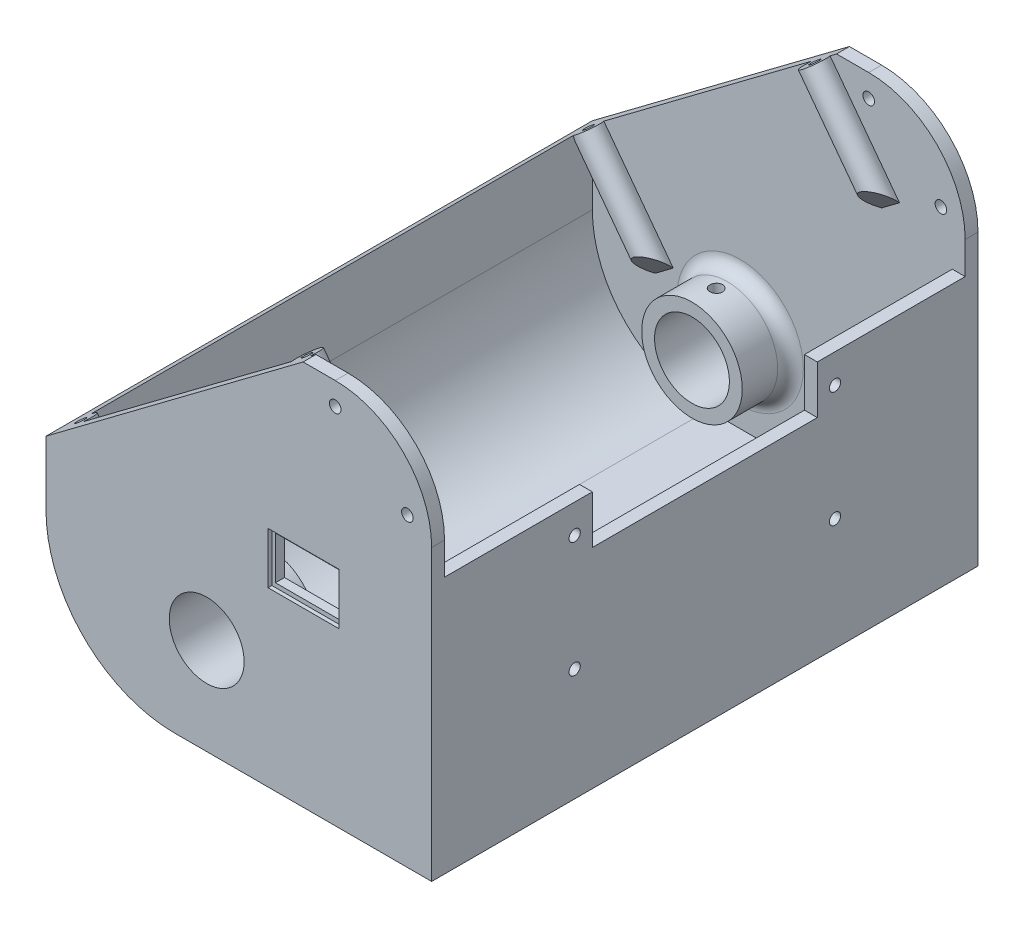
from build123d import *

# Parameters (mm, degrees)
SKETCH_1_R           = 11.65
SKETCH_1_R_2         = 1.8
EXTRUDE_1_DEPTH      = 170
SHELL_2_T            = -4
SKETCH_10_W          = 162
SKETCH_10_H          = 68.975267516
CUT_EXTRUDE_8_DEPTH  = 65
SKETCH_2_R           = 4
EXTRUDE_2_DEPTH      = 30
SKETCH_3_W           = 48.76473187
SKETCH_3_H           = 132
CUT_EXTRUDE_1_DEPTH  = 57
SKETCH_4_R           = 1.5
CUT_EXTRUDE_2_DEPTH  = 20
SKETCH_5_R           = 3.25
CUT_EXTRUDE_3_DEPTH  = 20
SKETCH_6_R           = 1.95
CUT_EXTRUDE_4_DEPTH  = 93
FILLET_1_R           = 4
CHAMFER_2_SIZE       = 6
SKETCH_7_W           = 70
SKETCH_7_H           = 15
CUT_EXTRUDE_5_DEPTH  = 39
SKETCH_9_W           = 25
SKETCH_9_H           = 25
CUT_EXTRUDE_7_DEPTH  = 39
SKETCH_11_R          = 1.75
CUT_EXTRUDE_9_DEPTH  = 10
SKETCH_8_W           = 19.8
SKETCH_8_H           = 13.4
CUT_EXTRUDE_10_DEPTH = 10
SKETCH_12_W          = 22
SKETCH_12_H          = 16
CUT_EXTRUDE_11_DEPTH = 1.2


with BuildPart() as part:
    # 草图1 → 凸台-拉伸1 (new body)
    with BuildSketch(Plane.XY):
        with BuildLine():
            Line((-6.571005291, -19.16114319), (73.428994709, -19.16114319))
            Line((73.428994709, -19.16114319), (73.428994709, 70.83885681))
            ThreePointArc((73.428994709, 70.83885681), (64.642198145, 92.052060245), (43.428994709, 100.83885681))
            Line((43.428994709, 100.83885681), (33.428994709, 100.83885681))
            Line((33.428994709, 100.83885681), (-46.571005291, 40.83885681))
            Line((-46.571005291, 40.83885681), (-46.571005291, 20.83885681))
            ThreePointArc((-46.571005291, 20.83885681), (-34.855276538, -7.445414438), (-6.571005291, -19.16114319))
        make_face()
        with Locations((3.428994709, 10.83885681)):
            Circle(SKETCH_1_R, mode=Mode.SUBTRACT)
        with Locations((43.428994709, 93.83885681)):
            Circle(SKETCH_1_R_2, mode=Mode.SUBTRACT)
        with Locations((65.87893903, 75.83885681)):
            Circle(SKETCH_1_R_2, mode=Mode.SUBTRACT)
    extrude(amount=EXTRUDE_1_DEPTH)

    # 抽壳2
    shell_2_openings = [part.faces().sort_by_distance(p)[0] for p in [
        (-6.571005291, 70.83885681, 85),
    ]]
    offset(amount=SHELL_2_T, openings=shell_2_openings)

    # 草图10 → 切除-拉伸8 (cut)
    with BuildSketch(Plane(origin=(73.428994709, 0, 0), x_dir=(0, 0, -1), z_dir=(1, 0, 0))):
        with Locations((-85, 95.326490568)):
            Rectangle(SKETCH_10_W, SKETCH_10_H)
    extrude(amount=-CUT_EXTRUDE_8_DEPTH, mode=Mode.SUBTRACT)

    # 草图2 → 凸台-拉伸2 (add)
    with BuildSketch(Plane(origin=(-36.368213173, 48.490950898, 0), x_dir=(0.8000000000000002, 0.6, 0), z_dir=(-0.6, 0.8000000000000002, 0))):
        with Locations((81.246509853, -6)):
            Circle(SKETCH_2_R)
        with Locations((-6.753490147, -6)):
            Circle(SKETCH_2_R)
        with Locations((81.246509853, -164)):
            Circle(SKETCH_2_R)
        with Locations((-6.753490147, -164)):
            Circle(SKETCH_2_R)
    extrude(amount=-EXTRUDE_2_DEPTH)

    # 草图3 → 切除-拉伸1 (cut)
    with BuildSketch(Plane(origin=(0, -12.16114319, 0), x_dir=(1, 0, 0), z_dir=(0, 1, 0))):
        with Locations((11.820994157, -85)):
            Rectangle(SKETCH_3_W, SKETCH_3_H)
    extrude(amount=CUT_EXTRUDE_1_DEPTH, mode=Mode.SUBTRACT)

    # 草图4 → 切除-拉伸2 (cut)
    with BuildSketch(Plane(origin=(-36.368213173, 48.490950898, 0), x_dir=(0.8000000000000002, 0.6, 0), z_dir=(-0.6, 0.8000000000000002, 0))):
        with Locations(Location((-6.753490147, -6, 0), (0, 0, 180))):
            Circle(SKETCH_4_R)
        with Locations((81.246509853, -6)):
            Circle(SKETCH_4_R)
        with Locations(Location((81.246509853, -164, 0), (0, 0, 180))):
            Circle(SKETCH_4_R)
        with Locations((-6.753490147, -164)):
            Circle(SKETCH_4_R)
    extrude(amount=-CUT_EXTRUDE_2_DEPTH, mode=Mode.SUBTRACT)

    # 草图5 → 切除-拉伸3 (cut)
    with BuildSketch(Plane(origin=(0, -15.16114319, 0), x_dir=(1, 0, 0), z_dir=(0, 1, 0))):
        with Locations(Location((23.428994709, -45, 0), (0, 0, 270))):
            Circle(SKETCH_5_R)
        with Locations(Location((39.428994709, -45, 0), (0, 0, 270))):
            Circle(SKETCH_5_R)
        with Locations(Location((23.428994709, -125, 0), (0, 0, 270))):
            Circle(SKETCH_5_R)
        with Locations(Location((39.428994709, -125, 0), (0, 0, 270))):
            Circle(SKETCH_5_R)
    extrude(amount=-CUT_EXTRUDE_3_DEPTH, mode=Mode.SUBTRACT)

    # 草图6 → 切除-拉伸4 (cut)
    with BuildSketch(Plane(origin=(0, 100.83885681, 0), x_dir=(1, 0, 0), z_dir=(0, 1, 0))):
        with Locations(Location((3.428994709, -158.5, 0), (0, 0, 270))):
            Circle(SKETCH_6_R)
        with Locations(Location((3.428994709, -11.5, 0), (0, 0, 270))):
            Circle(SKETCH_6_R)
    extrude(amount=-CUT_EXTRUDE_4_DEPTH, mode=Mode.SUBTRACT)

    # 圆角1
    fillet_1_edges = [part.edges().sort_by_distance(p)[0] for p in [
        (-12.221005291, 10.83885681, 4),
        (-12.221005291, 10.83885681, 166),
    ]]
    fillet(fillet_1_edges, radius=FILLET_1_R)

    # Chamfer 2
    chamfer_2_edges = [part.edges().sort_by_distance(p)[0] for p in [
        (-23.771005291, 20.43885681, 4),
        (46.628994709, 73.23885681, 4),
        (46.628994709, 73.23885681, 166),
        (-23.771005291, 20.43885681, 166),
    ]]
    chamfer(chamfer_2_edges, length=CHAMFER_2_SIZE - 0.0001)  # a hair under: the kernel refuses the full size

    # 草图7 → 切除-拉伸5 (cut)
    with BuildSketch(Plane(origin=(73.428994709, 0, 0), x_dir=(0, 0, -1), z_dir=(1, 0, 0))):
        with Locations((-85, 53.33885681)):
            Rectangle(SKETCH_7_W, SKETCH_7_H)
    extrude(amount=-CUT_EXTRUDE_5_DEPTH, mode=Mode.SUBTRACT)

    # 草图9 → 切除-拉伸7 (cut)
    with BuildSketch(Plane.XZ.offset(19.16114319)):
        with Locations((56.928994709, 153.5)):
            Rectangle(SKETCH_9_W, SKETCH_9_H)
    extrude(amount=-CUT_EXTRUDE_7_DEPTH, mode=Mode.SUBTRACT)

    # 草图11 → 切除-拉伸9 (cut)
    with BuildSketch(Plane.ZY.offset(-69.428994709)):
        with Locations((44.5, 51.83885681)):
            Circle(SKETCH_11_R)
        with Locations((44.5, 15.83885681)):
            Circle(SKETCH_11_R)
        with Locations((125.5, 15.83885681)):
            Circle(SKETCH_11_R)
        with Locations((125.5, 51.83885681)):
            Circle(SKETCH_11_R)
    extrude(amount=-CUT_EXTRUDE_9_DEPTH, mode=Mode.SUBTRACT)

    # 草图8 → 切除-拉伸10 (cut)
    with BuildSketch(Plane.XY.offset(170)):
        with Locations((33.528994709, 42.53885681)):
            Rectangle(SKETCH_8_W, SKETCH_8_H)
    extrude(amount=-CUT_EXTRUDE_10_DEPTH, mode=Mode.SUBTRACT)

    # 草图12 → 切除-拉伸11 (cut)
    with BuildSketch(Plane.XY.offset(170)):
        with Locations((33.528994709, 42.53885681)):
            Rectangle(SKETCH_12_W, SKETCH_12_H)
    extrude(amount=-CUT_EXTRUDE_11_DEPTH, mode=Mode.SUBTRACT)


solid = part.part
